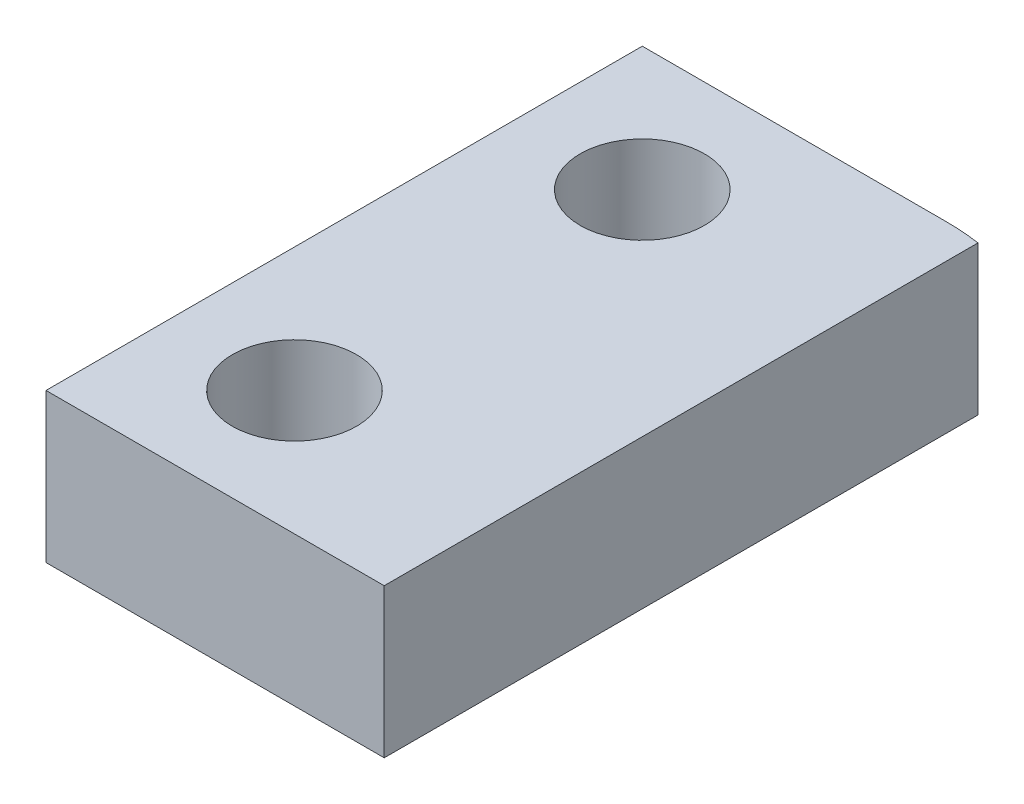
from build123d import *

# Parameters (mm, degrees)
SKETCH1_W           = 40
SKETCH1_H           = 12
BOSS_EXTRUDE1_DEPTH = 3
SKETCH3_R           = 1.25
CUT_EXTRUDE2_DEPTH  = 22.09502311
CUT_EXTRUDE3_DEPTH  = 10
FILLET2_R           = 5
FILLET3_R           = 1
FILLET4_R           = 5
FILLET5_R           = 5
SKETCH6_W           = 35.954210482
SKETCH6_H           = 25.866097198
CUT_EXTRUDE4_DEPTH  = 10


with BuildPart() as part:
    # Sketch1 → Boss-Extrude1 (new body)
    with BuildSketch(Plane(origin=(0, 0, 0), x_dir=(1, 0, 0), z_dir=(0, 1, 0))):
        Rectangle(SKETCH1_W, SKETCH1_H)
    extrude(amount=BOSS_EXTRUDE1_DEPTH)

    # Sketch3 → Cut-Extrude2 (cut, through all)
    with BuildSketch(Plane(origin=(0, 3, 0), x_dir=(1, 0, 0), z_dir=(0, 1, 0))):
        with Locations(Location((-17.5, 3.5, 0), (0, 0, 270))):
            Circle(SKETCH3_R)
        with Locations(Location((-17.5, -3.5, 0), (0, 0, 270))):
            Circle(SKETCH3_R)
    extrude(amount=-CUT_EXTRUDE2_DEPTH, mode=Mode.SUBTRACT)

    # Sketch5 → Cut-Extrude3 (cut)
    with BuildSketch(Plane(origin=(0, 3, 0), x_dir=(1, 0, 0), z_dir=(0, 1, 0))):
        with BuildLine():
            Line((-13.458222524, 6), (20, 0))
            Line((20, 0), (20, -6))
            Line((20, -6), (17.030073052, -6))
            ThreePointArc((17.030073052, -6), (7.671541519, -2.617819669), (-2.144608615, -4.250134828))
            Line((-2.144608615, -4.250134828), (-6.569653649, -6))
            Line((-6.569653649, -6), (-13.458222524, -6))
            Line((-13.458222524, -6), (-13.458222524, -10.237178745))
            Line((-13.458222524, -10.237178745), (26.023482417, -9.726914384))
            Line((26.023482417, -9.726914384), (26.023482417, 8.477274399))
            Line((26.023482417, 8.477274399), (-13.458222524, 8.477274399))
            Line((-13.458222524, 8.477274399), (-13.458222524, 6))
        make_face()
    extrude(amount=-CUT_EXTRUDE3_DEPTH, mode=Mode.SUBTRACT)

    # Fillet2
    # the kernel refuses this fillet: 5 mm, written as the material it takes off along each edge
    with BuildSketch(Plane(origin=(-6.569653649, 5.381801612, 6), x_dir=(-1, 0, 0), z_dir=(0, -1, 0))) as fillet2_piece_1:
        with BuildLine():
            CenterArc((FILLET2_R * 0.190544128998, FILLET2_R), FILLET2_R, 248.423891744, 21.576108256)
            Line((-FILLET2_R * 0.17719268457, FILLET2_R * 0.0700700908417), (0, 0))
            Line((0, 0), (FILLET2_R * 0.190544128998, 0))
        make_face()
    extrude(amount=7.763603225, mode=Mode.SUBTRACT)
    with BuildSketch(Plane(origin=(-2.144608615, 3.259446384, 4.250134828), x_dir=(-0.9299299091583175, 0, 0.36773681356753396), z_dir=(0, -1, 0))) as fillet2_piece_2:
        with BuildLine():
            CenterArc((0.103778554, 5), FILLET2_R, 267.749266862, 2.250733138)
            ThreePointArc((-0.092584454, 0.003857331), (-0.046289955, 0.001983199), (0, 0))
            Line((0, 0), (0.103778554, 0))
        make_face()
    extrude(amount=3.518892769, mode=Mode.SUBTRACT)
    with BuildSketch(Plane(origin=(17.030073052, 6.64587884, 6), x_dir=(1, 0, 0), z_dir=(0, -1, 0))) as fillet2_piece_3:
        with BuildLine():
            CenterArc((1.458351536, -5), FILLET2_R, 90, 30.730822568)
            ThreePointArc((-1.096675494, -0.70211251), (-0.542524687, -0.360136055), (0, 0))
            Line((0, 0), (1.458351536, 0))
        make_face()
    extrude(amount=10.291757681, mode=Mode.SUBTRACT)

    # Fillet3
    fillet3_edges = [part.edges().sort_by_distance(p)[0] for p in [
        (20, 1.5, 6),
    ]]
    fillet(fillet3_edges, radius=FILLET3_R)

    # Fillet4
    fillet4_edges = [part.edges().sort_by_distance(p)[0] for p in [
        (20, 1.5, 0),
    ]]
    fillet(fillet4_edges, radius=FILLET4_R)

    # Fillet5
    fillet5_edges = [part.edges().sort_by_distance(p)[0] for p in [
        (-13.458222524, 1.5, -6),
    ]]
    fillet(fillet5_edges, radius=FILLET5_R)

    # Sketch6 → Cut-Extrude4 (cut)
    with BuildSketch(Plane(origin=(0, 3, 0), x_dir=(1, 0, 0), z_dir=(0, 1, 0))):
        with Locations((4.783435461, -3.359387953)):
            Rectangle(SKETCH6_W, SKETCH6_H)
    extrude(amount=-CUT_EXTRUDE4_DEPTH, mode=Mode.SUBTRACT)


solid = part.part
